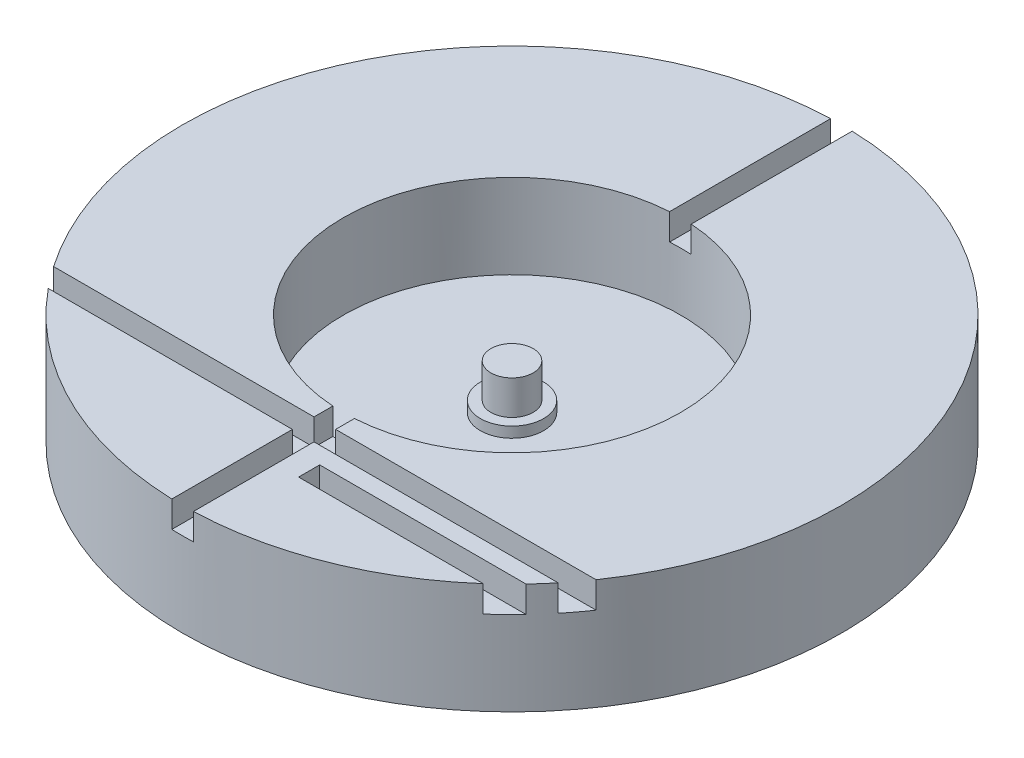
from build123d import *

# Parameters (mm, degrees)
SKETCH1_R           = 62.5
BOSS_EXTRUDE1_DEPTH = 21
SKETCH2_R           = 32
SKETCH2_R_2         = 6
CUT_EXTRUDE1_DEPTH  = 16
SKETCH3_R           = 6
SKETCH3_R_2         = 4
CUT_EXTRUDE2_DEPTH  = 14
SKETCH4_R           = 4
CUT_EXTRUDE3_DEPTH  = 7.5
CUT_EXTRUDE4_START  = -5
CUT_EXTRUDE4_DEPTH  = 5
CUT_EXTRUDE5_START  = -5
CUT_EXTRUDE5_DEPTH  = 5
CUT_EXTRUDE6_START  = -5
CUT_EXTRUDE6_DEPTH  = 5


with BuildPart() as part:
    # Sketch1 → Boss-Extrude1 (new body)
    with BuildSketch(Plane(origin=(0, 0, 0), x_dir=(1, 0, 0), z_dir=(0, 1, 0))):
        Circle(SKETCH1_R)
    extrude(amount=BOSS_EXTRUDE1_DEPTH)

    # Sketch2 → Cut-Extrude1 (cut)
    with BuildSketch(Plane(origin=(0, 21, 0), x_dir=(1, 0, 0), z_dir=(0, 1, 0))):
        Circle(SKETCH2_R)
        Circle(SKETCH2_R_2, mode=Mode.SUBTRACT)
    extrude(amount=-CUT_EXTRUDE1_DEPTH, mode=Mode.SUBTRACT)

    # Sketch3 → Cut-Extrude2 (cut)
    with BuildSketch(Plane(origin=(0, 21, 0), x_dir=(1, 0, 0), z_dir=(0, 1, 0))):
        Circle(SKETCH3_R)
        Circle(SKETCH3_R_2, mode=Mode.SUBTRACT)
    extrude(amount=-CUT_EXTRUDE2_DEPTH, mode=Mode.SUBTRACT)

    # Sketch4 → Cut-Extrude3 (cut)
    with BuildSketch(Plane(origin=(0, 21, 0), x_dir=(1, 0, 0), z_dir=(0, 1, 0))):
        Circle(SKETCH4_R)
    extrude(amount=-CUT_EXTRUDE3_DEPTH, mode=Mode.SUBTRACT)

    # Sketch5 → Cut-Extrude4 (cut)
    with BuildSketch(Plane(origin=(0, 21, 0), x_dir=(1, 0, 0), z_dir=(0, 1, 0)).offset(CUT_EXTRUDE4_START)):
        with BuildLine():
            Line((2.05, 62.466370953), (2.05, -62.466370953))
            ThreePointArc((2.05, -62.466370953), (0, -62.5), (-2.05, -62.466370953))
            Line((-2.05, -62.466370953), (-2.05, 62.466370953))
            ThreePointArc((-2.05, 62.466370953), (0, 62.5), (2.05, 62.466370953))
        make_face()
    extrude(amount=CUT_EXTRUDE4_DEPTH, mode=Mode.SUBTRACT)

    # Sketch6 → Cut-Extrude5 (cut)
    with BuildSketch(Plane(origin=(0, 21, 0), x_dir=(1, 0, 0), z_dir=(0, 1, 0)).offset(CUT_EXTRUDE5_START)):
        with BuildLine():
            Line((-48.35, -39.60463988), (48.35, -39.60463988))
            ThreePointArc((48.35, -39.60463988), (49.936833573, -37.584074456), (51.439284598, -35.5))
            Line((51.439284598, -35.5), (-51.439284598, -35.5))
            ThreePointArc((-51.439284598, -35.5), (-49.936833573, -37.584074456), (-48.35, -39.60463988))
        make_face()
    extrude(amount=CUT_EXTRUDE5_DEPTH, mode=Mode.SUBTRACT)

    # Sketch9 → Cut-Extrude6 (cut)
    with BuildSketch(Plane(origin=(0, 21, 0), x_dir=(1, 0, 0), z_dir=(0, 1, 0)).offset(CUT_EXTRUDE6_START)):
        with BuildLine():
            Line((45.500273824, -42.848279801), (6.37014237, -42.848279801))
            Line((6.37014237, -42.848279801), (6.37014237, -46.848279801))
            Line((6.37014237, -46.848279801), (41.37014237, -46.848279801))
            ThreePointArc((41.37014237, -46.848279801), (43.481229311, -44.895798217), (45.500273824, -42.848279801))
        make_face()
    extrude(amount=CUT_EXTRUDE6_DEPTH, mode=Mode.SUBTRACT)


solid = part.part
